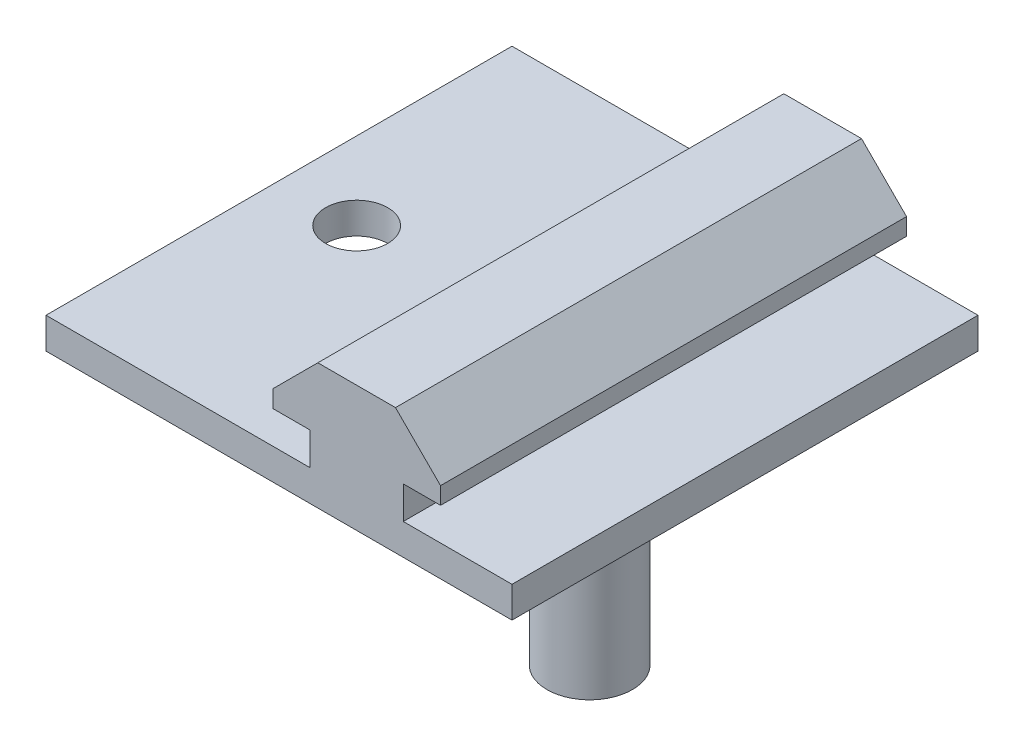
from build123d import *

# Parameters (mm, degrees)
BOSS_EXTRUDE2_DEPTH = 15
SKETCH4_R           = 2
CUT_EXTRUDE1_DEPTH  = 32.483487736
SKETCH5_R           = 2.75
BOSS_EXTRUDE3_DEPTH = 15


with BuildPart() as part:
    # Sketch2 → Boss-Extrude2 (new, symmetric)
    with BuildSketch(Plane.XY):
        Polygon((5.4, 3.2), (2.5, 6.1), (-2.5, 6.1), (-5.4, 3.2), (-5.4, 2.1), (-3, 2.1), (-3, 0), (-20, 0), (-20, -2), (10, -2), (10, 0), (3, 0), (3, 2.1), (5.4, 2.1), align=None)
    extrude(amount=BOSS_EXTRUDE2_DEPTH, both=True)

    # Sketch4 → Cut-Extrude1 (cut, through all)
    with BuildSketch(Plane(origin=(7, 0, 0), x_dir=(0, 0, 1), z_dir=(0, -1, 0))):
        with Locations((0, 22)):
            Circle(SKETCH4_R)
    extrude(amount=CUT_EXTRUDE1_DEPTH, mode=Mode.SUBTRACT)

    # Sketch5 → Boss-Extrude3 (add)
    with BuildSketch(Plane.XZ.offset(2)):
        Circle(SKETCH5_R)
    extrude(amount=BOSS_EXTRUDE3_DEPTH)


solid = part.part
